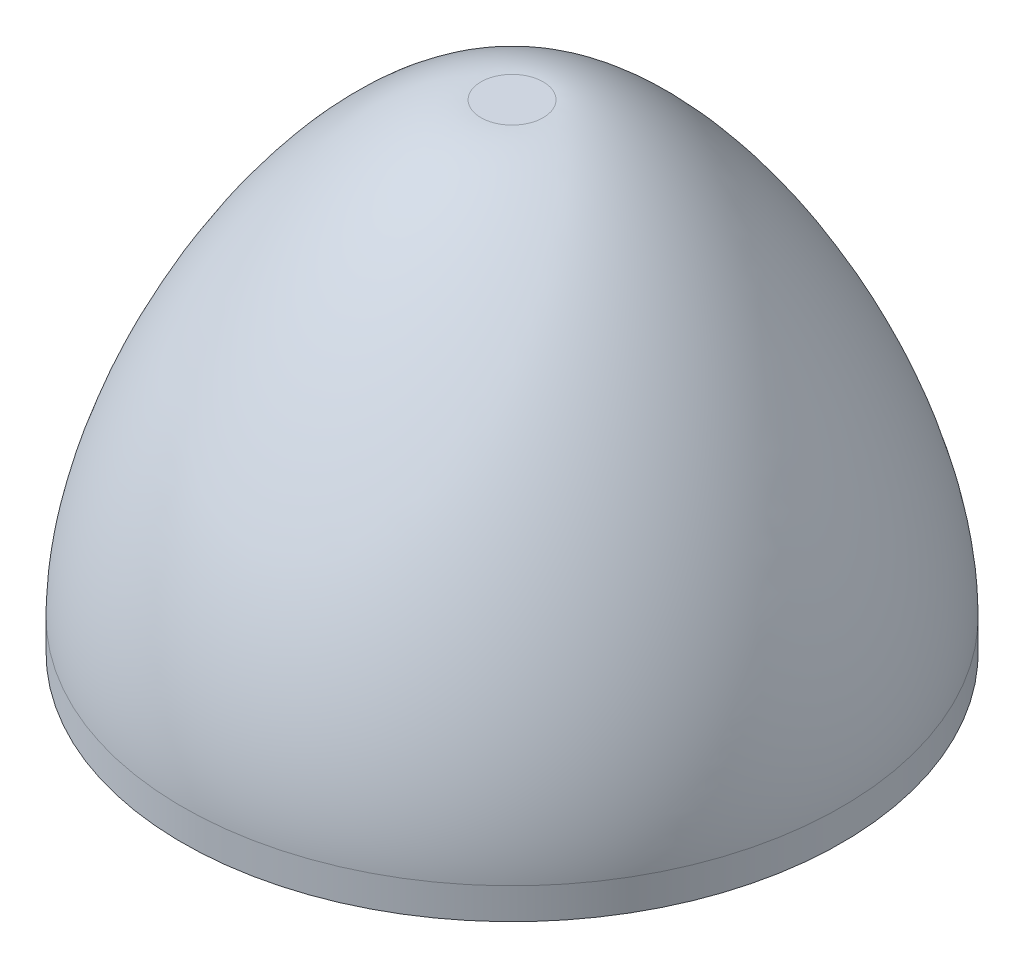
from build123d import *

# Parameters (mm, degrees)
THREAD2_PITCH = 1
THREAD2_TO    = 5


with BuildPart() as part:
    # Sketch1 → Revolve1 (revolve)
    with BuildSketch(Plane.XY, mode=Mode.PRIVATE) as revolve1_sk:
        with BuildLine():
            Line((0, 72), (0, 62))
            add(Edge.make_bspline(
                [(0, 62), (43, 62), (43, 0)],
                knots=[0, 0, 0, 1, 1, 1], degree=2, weights=[1, 0.428571429, 1]))
            Line((43, 0), (45, 0))
            ThreePointArc((45, 0), (45.76, 0.76), (46.52, 0))
            Line((46.52, 0), (49, 0))
            Line((49, 0), (51, 0))
            Line((51, 0), (51, -5))
            Line((51, -5), (53, -5))
            Line((53, -5), (53, 0))
            add(Edge.make_bspline(
                [(5, 72), (53, 72), (53, 0)],
                knots=[0, 0, 0, 1, 1, 1], degree=2, weights=[1, 0.428571429, 1]))
            Line((5, 72), (0, 72))
        make_face()
    revolve(revolve1_sk.sketch.rotate(Axis((0, 62, 0), (0, -1, 0)), 180), axis=Axis((0, 62, 0), (0, -1, 0)))

    # Thread2: arcs per turn and ends read off the stored shape
    # Thread2: the profile of Thread Profile3 profile screwed along a right-hand helix through 5 turns, 8 arcs to a turn; built about Z, then put on its axis
    thread2_z = Axis((0, 0, 0), (0, 0, 1))
    thread2_corners = [(51.0003, 0, -0.000173205), (51.0003, 0, 0.875173202), (50.458734125, 0, 0.562499999), (50.458734125, 0, 0.312499999)]
    with BuildLine(mode=Mode.PRIVATE) as thread2_profile:
        Line(thread2_corners[0], thread2_corners[1])
        Line(thread2_corners[1], thread2_corners[2])
        Line(thread2_corners[2], thread2_corners[3])
        Line(thread2_corners[3], thread2_corners[0])
    thread2_cap = Face(thread2_profile.wire())
    thread2_turn_angles = [0, 22.5, 45, 67.5, 90, 112.5, 135, 157.5, 180, 202.5, 225, 247.5, 270, 292.5, 315, 337.5, 360]
    thread2_turn_weights = [1, 0.9238795325112867, 1, 0.9238795325112867, 1, 0.9238795325112867, 1, 0.9238795325112867, 1, 0.9238795325112867, 1, 0.9238795325112867, 1, 0.9238795325112867, 1, 0.9238795325112867, 1]
    thread2_turn_rails = [Edge.make_bspline([Vector(p[0], p[1], 0).rotate(thread2_z, thread2_turn_angles[k]) / thread2_turn_weights[k] + Vector(0, 0, p[2] + THREAD2_PITCH * thread2_turn_angles[k] / 360) for k in range(17)], [0, 0, 0, 1, 1, 2, 2, 3, 3, 4, 4, 5, 5, 6, 6, 7, 7, 8, 8, 8], 2, thread2_turn_weights) for p in thread2_corners]
    thread2_turn_sides = [Face.make_surface_from_curves(thread2_turn_rails[p[0]], thread2_turn_rails[p[1]]) for p in [(0, 1), (1, 2), (2, 3), (3, 0)]]
    thread2 = Plane(origin=(0, 0, 0), x_dir=(-1, 0, 0), z_dir=(0, -1, 0)) * split(Solid(Shell([*[p.moved(Location((0, 0, THREAD2_PITCH * i))) for i in range(5) for p in thread2_turn_sides], thread2_cap, thread2_cap.rotate(thread2_z, 1800).moved(Location((0, 0, THREAD2_PITCH * 1800 / 360)))])), bisect_by=Plane.XY.offset(THREAD2_TO), keep=Keep.BOTTOM, mode=Mode.PRIVATE)
    add(thread2)


solid = part.part
